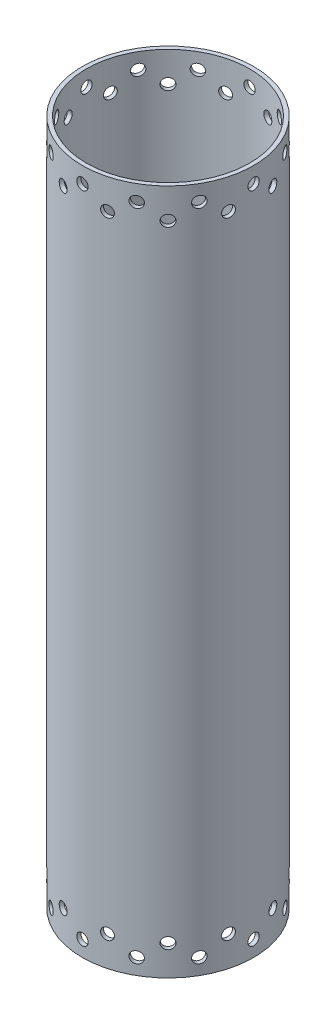
from build123d import *

# Parameters (mm, degrees)
SKETCH2_R                = 76.2
SKETCH2_R_2              = 72.5932
BOSS_EXTRUDE1_DEPTH      = 609.6
SKETCH3_R                = 5.0419
CUT_EXTRUDE1_DEPTH       = 1143
SKETCH6_R                = 5.0419
CUT_EXTRUDE2_DEPTH       = 25.4
CIRPATTERN2_COUNT        = 12
MIRROR1_COPY_1_SKETCH_R  = 5.0419
MIRROR1_COPY_1_DEPTH     = 1143
MIRROR1_COPY_2_SKETCH_R  = 5.0419
MIRROR1_COPY_2_DEPTH     = 1143
MIRROR1_COPY_3_SKETCH_R  = 5.0419
MIRROR1_COPY_3_DEPTH     = 1143
MIRROR1_COPY_4_SKETCH_R  = 5.0419
MIRROR1_COPY_4_DEPTH     = 1143
MIRROR1_COPY_5_SKETCH_R  = 5.0419
MIRROR1_COPY_5_DEPTH     = 1143
MIRROR1_COPY_6_SKETCH_R  = 5.0419
MIRROR1_COPY_6_DEPTH     = 1143
MIRROR1_COPY_7_SKETCH_R  = 5.0419
MIRROR1_COPY_7_DEPTH     = 1143
MIRROR1_COPY_8_SKETCH_R  = 5.0419
MIRROR1_COPY_8_DEPTH     = 1143
MIRROR1_COPY_9_SKETCH_R  = 5.0419
MIRROR1_COPY_9_DEPTH     = 1143
MIRROR1_COPY_10_SKETCH_R = 5.0419
MIRROR1_COPY_10_DEPTH    = 1143
MIRROR1_COPY_11_SKETCH_R = 5.0419
MIRROR1_COPY_11_DEPTH    = 1143
MIRROR1_COPY_12_SKETCH_R = 5.0419
MIRROR1_COPY_12_DEPTH    = 25.4
MIRROR1_COPY_13_SKETCH_R = 5.0419
MIRROR1_COPY_13_DEPTH    = 25.4
MIRROR1_COPY_14_SKETCH_R = 5.0419
MIRROR1_COPY_14_DEPTH    = 25.4
MIRROR1_COPY_15_SKETCH_R = 5.0419
MIRROR1_COPY_15_DEPTH    = 25.4
MIRROR1_COPY_16_SKETCH_R = 5.0419
MIRROR1_COPY_16_DEPTH    = 25.4
MIRROR1_COPY_17_SKETCH_R = 5.0419
MIRROR1_COPY_17_DEPTH    = 25.4
MIRROR1_COPY_18_SKETCH_R = 5.0419
MIRROR1_COPY_18_DEPTH    = 25.4
MIRROR1_COPY_19_SKETCH_R = 5.0419
MIRROR1_COPY_19_DEPTH    = 25.4
MIRROR1_COPY_20_SKETCH_R = 5.0419
MIRROR1_COPY_20_DEPTH    = 25.4
MIRROR1_COPY_21_SKETCH_R = 5.0419
MIRROR1_COPY_21_DEPTH    = 25.4
MIRROR1_COPY_22_SKETCH_R = 5.0419
MIRROR1_COPY_22_DEPTH    = 25.4
MIRROR1_COPY_23_SKETCH_R = 5.0419
MIRROR1_COPY_23_DEPTH    = 1143
MIRROR1_COPY_24_SKETCH_R = 5.0419
MIRROR1_COPY_24_DEPTH    = 25.4


with BuildPart() as part:
    # Sketch2 → Boss-Extrude1 (new body)
    with BuildSketch(Plane(origin=(0, 0, 0), x_dir=(1, 0, 0), z_dir=(0, 1, 0))):
        Circle(SKETCH2_R)
        Circle(SKETCH2_R_2, mode=Mode.SUBTRACT)
    extrude(amount=BOSS_EXTRUDE1_DEPTH)

    # Sketch3 → Cut-Extrude1 (cut)
    with BuildSketch(Plane.XY):
        with Locations((0, 595.503)):
            Circle(SKETCH3_R)
    cut_extrude1 = extrude(amount=-CUT_EXTRUDE1_DEPTH, mode=Mode.SUBTRACT)

    # Sketch6 → Cut-Extrude2 (cut)
    with BuildSketch(Plane(origin=(-19.722011237, 0, 73.603547963), x_dir=(0, -1, 0), z_dir=(-0.25881904510252135, 0, 0.9659258262890681))):
        with Locations((-582.803, 0)):
            Circle(SKETCH6_R)
    cut_extrude2 = extrude(amount=-CUT_EXTRUDE2_DEPTH, mode=Mode.SUBTRACT)

    # CirPattern2: Cut-Extrude1, Cut-Extrude2 ×12 about axis
    cirpattern2_axis = Axis((0, 609.6, 0), (0, -1, 0))
    add([cut_extrude1.rotate(cirpattern2_axis, i * 360 / CIRPATTERN2_COUNT) for i in range(1, CIRPATTERN2_COUNT)], mode=Mode.SUBTRACT)
    add([cut_extrude2.rotate(cirpattern2_axis, i * 360 / CIRPATTERN2_COUNT) for i in range(1, CIRPATTERN2_COUNT)], mode=Mode.SUBTRACT)

    # Mirror1 copy 1 sketch → Mirror1 copy 1 (cut)
    with BuildSketch(Plane(origin=(0, 609.6, 0), x_dir=(0.8660254037844387, 0, 0.49999999999999994), z_dir=(-0.49999999999999994, 0, 0.8660254037844387))):
        with Locations((0, -595.503)):
            Circle(MIRROR1_COPY_1_SKETCH_R)
    extrude(amount=-MIRROR1_COPY_1_DEPTH, mode=Mode.SUBTRACT)

    # Mirror1 copy 2 sketch → Mirror1 copy 2 (cut)
    with BuildSketch(Plane(origin=(0, 609.6, 0), x_dir=(0.5000000000000001, 0, 0.8660254037844386), z_dir=(-0.8660254037844386, 0, 0.5000000000000001))):
        with Locations((0, -595.503)):
            Circle(MIRROR1_COPY_2_SKETCH_R)
    extrude(amount=-MIRROR1_COPY_2_DEPTH, mode=Mode.SUBTRACT)

    # Mirror1 copy 3 sketch → Mirror1 copy 3 (cut)
    with BuildSketch(Plane(origin=(0, 609.6, 0), x_dir=(0, 0, 1), z_dir=(-1, 0, 0))):
        with Locations((0, -595.503)):
            Circle(MIRROR1_COPY_3_SKETCH_R)
    extrude(amount=-MIRROR1_COPY_3_DEPTH, mode=Mode.SUBTRACT)

    # Mirror1 copy 4 sketch → Mirror1 copy 4 (cut)
    with BuildSketch(Plane(origin=(0, 609.6, 0), x_dir=(-0.4999999999999998, 0, 0.8660254037844387), z_dir=(-0.8660254037844387, 0, -0.4999999999999998))):
        with Locations((0, -595.503)):
            Circle(MIRROR1_COPY_4_SKETCH_R)
    extrude(amount=-MIRROR1_COPY_4_DEPTH, mode=Mode.SUBTRACT)

    # Mirror1 copy 5 sketch → Mirror1 copy 5 (cut)
    with BuildSketch(Plane(origin=(0, 609.6, 0), x_dir=(-0.8660254037844387, 0, 0.49999999999999994), z_dir=(-0.49999999999999994, 0, -0.8660254037844387))):
        with Locations((0, -595.503)):
            Circle(MIRROR1_COPY_5_SKETCH_R)
    extrude(amount=-MIRROR1_COPY_5_DEPTH, mode=Mode.SUBTRACT)

    # Mirror1 copy 6 sketch → Mirror1 copy 6 (cut)
    with BuildSketch(Plane(origin=(0, 609.6, 0), x_dir=(-1, 0, 0), z_dir=(0, 0, -1))):
        with Locations((0, -595.503)):
            Circle(MIRROR1_COPY_6_SKETCH_R)
    extrude(amount=-MIRROR1_COPY_6_DEPTH, mode=Mode.SUBTRACT)

    # Mirror1 copy 7 sketch → Mirror1 copy 7 (cut)
    with BuildSketch(Plane(origin=(0, 609.6, 0), x_dir=(-0.8660254037844386, 0, -0.5000000000000001), z_dir=(0.5000000000000001, 0, -0.8660254037844386))):
        with Locations((0, -595.503)):
            Circle(MIRROR1_COPY_7_SKETCH_R)
    extrude(amount=-MIRROR1_COPY_7_DEPTH, mode=Mode.SUBTRACT)

    # Mirror1 copy 8 sketch → Mirror1 copy 8 (cut)
    with BuildSketch(Plane(origin=(0, 609.6, 0), x_dir=(-0.5000000000000004, 0, -0.8660254037844384), z_dir=(0.8660254037844384, 0, -0.5000000000000004))):
        with Locations((0, -595.503)):
            Circle(MIRROR1_COPY_8_SKETCH_R)
    extrude(amount=-MIRROR1_COPY_8_DEPTH, mode=Mode.SUBTRACT)

    # Mirror1 copy 9 sketch → Mirror1 copy 9 (cut)
    with BuildSketch(Plane(origin=(0, 609.6, 0), x_dir=(0, 0, -1), z_dir=(1, 0, 0))):
        with Locations((0, -595.503)):
            Circle(MIRROR1_COPY_9_SKETCH_R)
    extrude(amount=-MIRROR1_COPY_9_DEPTH, mode=Mode.SUBTRACT)

    # Mirror1 copy 10 sketch → Mirror1 copy 10 (cut)
    with BuildSketch(Plane(origin=(0, 609.6, 0), x_dir=(0.5000000000000001, 0, -0.8660254037844386), z_dir=(0.8660254037844386, 0, 0.5000000000000001))):
        with Locations((0, -595.503)):
            Circle(MIRROR1_COPY_10_SKETCH_R)
    extrude(amount=-MIRROR1_COPY_10_DEPTH, mode=Mode.SUBTRACT)

    # Mirror1 copy 11 sketch → Mirror1 copy 11 (cut)
    with BuildSketch(Plane(origin=(0, 609.6, 0), x_dir=(0.8660254037844384, 0, -0.5000000000000004), z_dir=(0.5000000000000004, 0, 0.8660254037844384))):
        with Locations((0, -595.503)):
            Circle(MIRROR1_COPY_11_SKETCH_R)
    extrude(amount=-MIRROR1_COPY_11_DEPTH, mode=Mode.SUBTRACT)

    # Mirror1 copy 12 sketch → Mirror1 copy 12 (cut)
    with BuildSketch(Plane(origin=(-53.881536726, 609.6, 53.881536726), x_dir=(0, 1, 0), z_dir=(-0.7071067811865479, 0, 0.7071067811865472))):
        with Locations((-582.803, 0)):
            Circle(MIRROR1_COPY_12_SKETCH_R)
    extrude(amount=-MIRROR1_COPY_12_DEPTH, mode=Mode.SUBTRACT)

    # Mirror1 copy 13 sketch → Mirror1 copy 13 (cut)
    with BuildSketch(Plane(origin=(-73.603547963, 609.6, 19.722011237), x_dir=(0, 1, 0), z_dir=(-0.9659258262890684, 0, 0.2588190451025203))):
        with Locations((-582.803, 0)):
            Circle(MIRROR1_COPY_13_SKETCH_R)
    extrude(amount=-MIRROR1_COPY_13_DEPTH, mode=Mode.SUBTRACT)

    # Mirror1 copy 14 sketch → Mirror1 copy 14 (cut)
    with BuildSketch(Plane(origin=(-73.603547963, 609.6, -19.722011237), x_dir=(0, 1, 0), z_dir=(-0.9659258262890681, 0, -0.2588190451025213))):
        with Locations((-582.803, 0)):
            Circle(MIRROR1_COPY_14_SKETCH_R)
    extrude(amount=-MIRROR1_COPY_14_DEPTH, mode=Mode.SUBTRACT)

    # Mirror1 copy 15 sketch → Mirror1 copy 15 (cut)
    with BuildSketch(Plane(origin=(-53.881536726, 609.6, -53.881536726), x_dir=(0, 1, 0), z_dir=(-0.7071067811865472, 0, -0.7071067811865477))):
        with Locations((-582.803, 0)):
            Circle(MIRROR1_COPY_15_SKETCH_R)
    extrude(amount=-MIRROR1_COPY_15_DEPTH, mode=Mode.SUBTRACT)

    # Mirror1 copy 16 sketch → Mirror1 copy 16 (cut)
    with BuildSketch(Plane(origin=(-19.722011237, 609.6, -73.603547963), x_dir=(0, 1, 0), z_dir=(-0.2588190451025201, 0, -0.9659258262890684))):
        with Locations((-582.803, 0)):
            Circle(MIRROR1_COPY_16_SKETCH_R)
    extrude(amount=-MIRROR1_COPY_16_DEPTH, mode=Mode.SUBTRACT)

    # Mirror1 copy 17 sketch → Mirror1 copy 17 (cut)
    with BuildSketch(Plane(origin=(19.722011237, 609.6, -73.603547963), x_dir=(0, 1, 0), z_dir=(0.25881904510252124, 0, -0.9659258262890681))):
        with Locations((-582.803, 0)):
            Circle(MIRROR1_COPY_17_SKETCH_R)
    extrude(amount=-MIRROR1_COPY_17_DEPTH, mode=Mode.SUBTRACT)

    # Mirror1 copy 18 sketch → Mirror1 copy 18 (cut)
    with BuildSketch(Plane(origin=(53.881536726, 609.6, -53.881536726), x_dir=(0, 1, 0), z_dir=(0.707106781186548, 0, -0.707106781186547))):
        with Locations((-582.803, 0)):
            Circle(MIRROR1_COPY_18_SKETCH_R)
    extrude(amount=-MIRROR1_COPY_18_DEPTH, mode=Mode.SUBTRACT)

    # Mirror1 copy 19 sketch → Mirror1 copy 19 (cut)
    with BuildSketch(Plane(origin=(73.603547963, 609.6, -19.722011237), x_dir=(0, 1, 0), z_dir=(0.9659258262890683, 0, -0.25881904510252063))):
        with Locations((-582.803, 0)):
            Circle(MIRROR1_COPY_19_SKETCH_R)
    extrude(amount=-MIRROR1_COPY_19_DEPTH, mode=Mode.SUBTRACT)

    # Mirror1 copy 20 sketch → Mirror1 copy 20 (cut)
    with BuildSketch(Plane(origin=(73.603547963, 609.6, 19.722011237), x_dir=(0, 1, 0), z_dir=(0.9659258262890681, 0, 0.2588190451025212))):
        with Locations((-582.803, 0)):
            Circle(MIRROR1_COPY_20_SKETCH_R)
    extrude(amount=-MIRROR1_COPY_20_DEPTH, mode=Mode.SUBTRACT)

    # Mirror1 copy 21 sketch → Mirror1 copy 21 (cut)
    with BuildSketch(Plane(origin=(53.881536726, 609.6, 53.881536726), x_dir=(0, 1, 0), z_dir=(0.707106781186547, 0, 0.707106781186548))):
        with Locations((-582.803, 0)):
            Circle(MIRROR1_COPY_21_SKETCH_R)
    extrude(amount=-MIRROR1_COPY_21_DEPTH, mode=Mode.SUBTRACT)

    # Mirror1 copy 22 sketch → Mirror1 copy 22 (cut)
    with BuildSketch(Plane(origin=(19.722011237, 609.6, 73.603547963), x_dir=(0, 1, 0), z_dir=(0.25881904510252063, 0, 0.9659258262890683))):
        with Locations((-582.803, 0)):
            Circle(MIRROR1_COPY_22_SKETCH_R)
    extrude(amount=-MIRROR1_COPY_22_DEPTH, mode=Mode.SUBTRACT)

    # Mirror1 copy 23 sketch → Mirror1 copy 23 (cut)
    with BuildSketch(Plane(origin=(0, 609.6, 0), x_dir=(1, 0, 0), z_dir=(0, 0, 1))):
        with Locations((0, -595.503)):
            Circle(MIRROR1_COPY_23_SKETCH_R)
    extrude(amount=-MIRROR1_COPY_23_DEPTH, mode=Mode.SUBTRACT)

    # Mirror1 copy 24 sketch → Mirror1 copy 24 (cut)
    with BuildSketch(Plane(origin=(-19.722011237, 609.6, 73.603547963), x_dir=(0, 1, 0), z_dir=(-0.25881904510252135, 0, 0.9659258262890681))):
        with Locations((-582.803, 0)):
            Circle(MIRROR1_COPY_24_SKETCH_R)
    extrude(amount=-MIRROR1_COPY_24_DEPTH, mode=Mode.SUBTRACT)


solid = part.part
